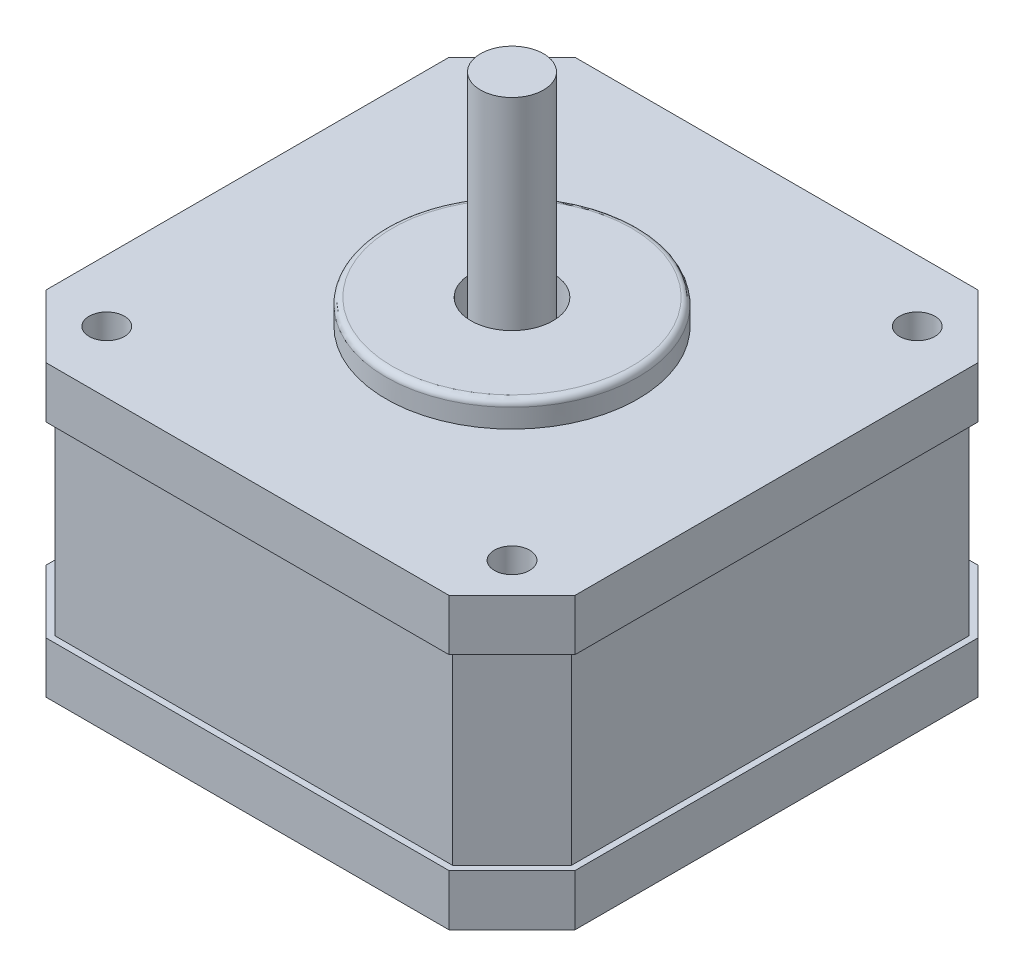
from build123d import *

# Parameters (mm, degrees)
IZIM1_W                     = 42
IZIM1_H                     = 42
Y_KSEKLIK_EKSTR_ZYON1_DEPTH = 23
IZIM2_W                     = 71.608863679
IZIM2_H                     = 14.84454832
KES_EKSTR_ZYON1_DEPTH       = 0.5
PAH1_SIZE                   = 5
PAH2_SIZE                   = 5
PAH3_SIZE                   = 5
PAH4_SIZE                   = 5
IZIM3_W                     = 11.40471201
IZIM3_H                     = 14.84454832
KES_EKSTR_ZYON2_DEPTH       = 10.5
IZIM6_W                     = 48.50384319
IZIM6_H                     = 14.84454832
KES_EKSTR_ZYON3_DEPTH       = 0.5
IZIM7_W                     = 38.182763894
IZIM7_H                     = 14.84454832
KES_EKSTR_ZYON4_DEPTH       = 0.5
AYNALAMA3_COPY_1_SKETCH_W   = 11.40471201
AYNALAMA3_COPY_1_SKETCH_H   = 14.84454832
AYNALAMA3_COPY_1_DEPTH      = 10.5
AYNALAMA3_COPY_2_SKETCH_W   = 11.40471201
AYNALAMA3_COPY_2_SKETCH_H   = 14.84454832
AYNALAMA3_COPY_2_DEPTH      = 10.5
IZIM8_R                     = 1.399371897
KES_EKSTR_ZYON5_DEPTH       = 5
IZIM9_R                     = 10
Y_KSEKLIK_EKSTR_ZYON2_DEPTH = 2
KES_EKSTR_ZYON6_DEPTH       = 5
KES_EKSTR_ZYON6_DEPTH_BACK  = 2.5
IZIM10_R                    = 3.25
IZIM11_R                    = 2.5
Y_KSEKLIK_EKSTR_ZYON3_DEPTH = 20
RADYUS2_R                   = 0.5


with BuildPart() as part:
    # Çizim1 → Yükseklik-Ekstrüzyon1 (new body)
    with BuildSketch(Plane(origin=(0, 0, 0), x_dir=(1, 0, 0), z_dir=(0, 1, 0))):
        Rectangle(IZIM1_W, IZIM1_H)
    extrude(amount=Y_KSEKLIK_EKSTR_ZYON1_DEPTH)

    # Çizim2 → Kes-Ekstrüzyon1 (cut)
    with BuildSketch(Plane.XY.offset(21)):
        with Locations((-0.989717409, 11.5)):
            Rectangle(IZIM2_W, IZIM2_H)
    kes_ekstr_zyon1 = extrude(amount=-KES_EKSTR_ZYON1_DEPTH, mode=Mode.SUBTRACT)

    # Pah1
    # the kernel refuses this chamfer: 5 mm, written as the material it takes off along each edge
    with BuildSketch(Plane(origin=(-21, -12.85841494, 21), x_dir=(0.9996219169112968, 0, 0.027495876610586317), z_dir=(0, 1, 0))) as pah1_piece_1:
        Polygon((PAH1_SIZE * 0.999621916911, PAH1_SIZE * 0.0274958766106), (-PAH1_SIZE * 0.0274958766106, PAH1_SIZE * 0.999621916911), (0, 0), align=None)
    extrude(amount=29.79455572, mode=Mode.SUBTRACT)
    with BuildSketch(Plane(origin=(-21, 6.06385922, 21), x_dir=(-0.027495876610586317, 0, -0.9996219169112968), z_dir=(0, 1, 0))) as pah1_piece_2:
        Polygon((PAH1_SIZE * 0.999621916911, -PAH1_SIZE * 0.0274958766106), (-PAH1_SIZE * 0.0274958766106, -PAH1_SIZE * 0.999621916911), (0, 0), align=None)
    extrude(amount=29.79455572, mode=Mode.SUBTRACT)

    # Pah2
    # the kernel refuses this chamfer: 5 mm, written as the material it takes off along each edge
    with BuildSketch(Plane(origin=(21, -12.85841494, 21), x_dir=(-0.9996219169112968, 0, 0.027495876610586317), z_dir=(0, 1, 0)), Plane(origin=(21, 6.06385922, 21), x_dir=(-0.9996219169112968, 0, 0.027495876610586317), z_dir=(0, 1, 0))) as pah2_piece_1:
        Polygon((PAH2_SIZE * 0.999621916911, -PAH2_SIZE * 0.0274958766106), (-PAH2_SIZE * 0.0274958766106, -PAH2_SIZE * 0.999621916911), (0, 0), align=None)
    extrude(amount=29.79455572, mode=Mode.SUBTRACT)

    # Pah3
    pah3_edges = [part.edges().sort_by_distance(p)[0] for p in [
        (21, 11.5, -21),
    ]]
    chamfer(pah3_edges, length=PAH3_SIZE)

    # Pah4
    pah4_edges = [part.edges().sort_by_distance(p)[0] for p in [
        (-21, 11.5, -21),
    ]]
    chamfer(pah4_edges, length=PAH4_SIZE)

    # Çizim3 → Kes-Ekstrüzyon2 (cut)
    with BuildSketch(Plane(origin=(-25.571067812, 0, 25.571067812), x_dir=(0.707106781186546, 0, 0.707106781186549), z_dir=(-0.707106781186549, 0, 0.707106781186546))):
        with Locations((0, 11.5)):
            Rectangle(IZIM3_W, IZIM3_H)
    kes_ekstr_zyon2 = extrude(amount=-KES_EKSTR_ZYON2_DEPTH, mode=Mode.SUBTRACT)

    # Aynalama1: Kes-Ekstrüzyon1, Kes-Ekstrüzyon2 across plane
    add(kes_ekstr_zyon1.mirror(Plane.XY), mode=Mode.SUBTRACT)
    add(kes_ekstr_zyon2.mirror(Plane.XY), mode=Mode.SUBTRACT)

    # Aynalama2: Kes-Ekstrüzyon2 across plane
    add(kes_ekstr_zyon2.mirror(Plane(origin=(0, 0, 0), x_dir=(0, 0, 1), z_dir=(1, 0, 0))), mode=Mode.SUBTRACT)

    # Çizim6 → Kes-Ekstrüzyon3 (cut)
    with BuildSketch(Plane(origin=(21, 0, 0), x_dir=(0, 0, -1), z_dir=(1, 0, 0))):
        with Locations((0, 11.5)):
            Rectangle(IZIM6_W, IZIM6_H)
    extrude(amount=-KES_EKSTR_ZYON3_DEPTH, mode=Mode.SUBTRACT)

    # Çizim7 → Kes-Ekstrüzyon4 (cut)
    with BuildSketch(Plane.ZY.offset(21)):
        with Locations((0, 11.5)):
            Rectangle(IZIM7_W, IZIM7_H)
    extrude(amount=-KES_EKSTR_ZYON4_DEPTH, mode=Mode.SUBTRACT)

    # Aynalama3 copy 1 sketch → Aynalama3 copy 1 (cut)
    with BuildSketch(Plane(origin=(25.571067812, 0, -25.571067812), x_dir=(-0.707106781186546, 0, -0.707106781186549), z_dir=(0.707106781186549, 0, -0.707106781186546))):
        with Locations((0, 11.5)):
            Rectangle(AYNALAMA3_COPY_1_SKETCH_W, AYNALAMA3_COPY_1_SKETCH_H)
    extrude(amount=-AYNALAMA3_COPY_1_DEPTH, mode=Mode.SUBTRACT)

    # Aynalama3 copy 2 sketch → Aynalama3 copy 2 (cut)
    with BuildSketch(Plane(origin=(-25.571067812, 0, -25.571067812), x_dir=(0.707106781186546, 0, -0.707106781186549), z_dir=(-0.707106781186549, 0, -0.707106781186546))):
        with Locations((0, -11.5)):
            Rectangle(AYNALAMA3_COPY_2_SKETCH_W, AYNALAMA3_COPY_2_SKETCH_H)
    extrude(amount=-AYNALAMA3_COPY_2_DEPTH, mode=Mode.SUBTRACT)

    # Çizim8 → Kes-Ekstrüzyon5 (cut)
    with BuildSketch(Plane(origin=(0, 23, 0), x_dir=(1, 0, 0), z_dir=(0, 1, 0))):
        with Locations(Location((-16.087568017, 16.087568017, 0), (0, 0, 270))):
            Circle(IZIM8_R)
        with Locations(Location((16.087568017, 16.087568017, 0), (0, 0, 90))):
            Circle(IZIM8_R)
        with Locations(Location((16.087568017, -16.087568017, 0), (0, 0, 270))):
            Circle(IZIM8_R)
        with Locations(Location((-16.087568017, -16.087568017, 0), (0, 0, 90))):
            Circle(IZIM8_R)
    extrude(amount=-KES_EKSTR_ZYON5_DEPTH, mode=Mode.SUBTRACT)

    # Çizim9 → Yükseklik-Ekstrüzyon2 (add)
    with BuildSketch(Plane(origin=(0, 23, 0), x_dir=(1, 0, 0), z_dir=(0, 1, 0))):
        with Locations(Location((0, 0, 0), (0, 0, 90))):
            Circle(IZIM9_R)
    extrude(amount=Y_KSEKLIK_EKSTR_ZYON2_DEPTH)

    # Çizim10 → Kes-Ekstrüzyon6 (cut, two sides: drawn at the far end of the back side and taken through both)
    with BuildSketch(Plane(origin=(0, 23, 0), x_dir=(1, 0, 0), z_dir=(0, 1, 0)).offset(-KES_EKSTR_ZYON6_DEPTH_BACK)):
        with Locations(Location((0, 0, 0), (0, 0, 270))):
            Circle(IZIM10_R)
    extrude(amount=KES_EKSTR_ZYON6_DEPTH + KES_EKSTR_ZYON6_DEPTH_BACK, mode=Mode.SUBTRACT)

    # Çizim11 → Yükseklik-Ekstrüzyon3 (add)
    with BuildSketch(Plane(origin=(0, 20.5, 0), x_dir=(1, 0, 0), z_dir=(0, 1, 0))):
        with Locations(Location((0, 0, 0), (0, 0, 270))):
            Circle(IZIM11_R)
    extrude(amount=Y_KSEKLIK_EKSTR_ZYON3_DEPTH)

    # Radyus2
    radyus2_edges = [part.edges().sort_by_distance(p)[0] for p in [
        (0, 25, 10),
    ]]
    fillet(radyus2_edges, radius=RADYUS2_R)


solid = part.part
